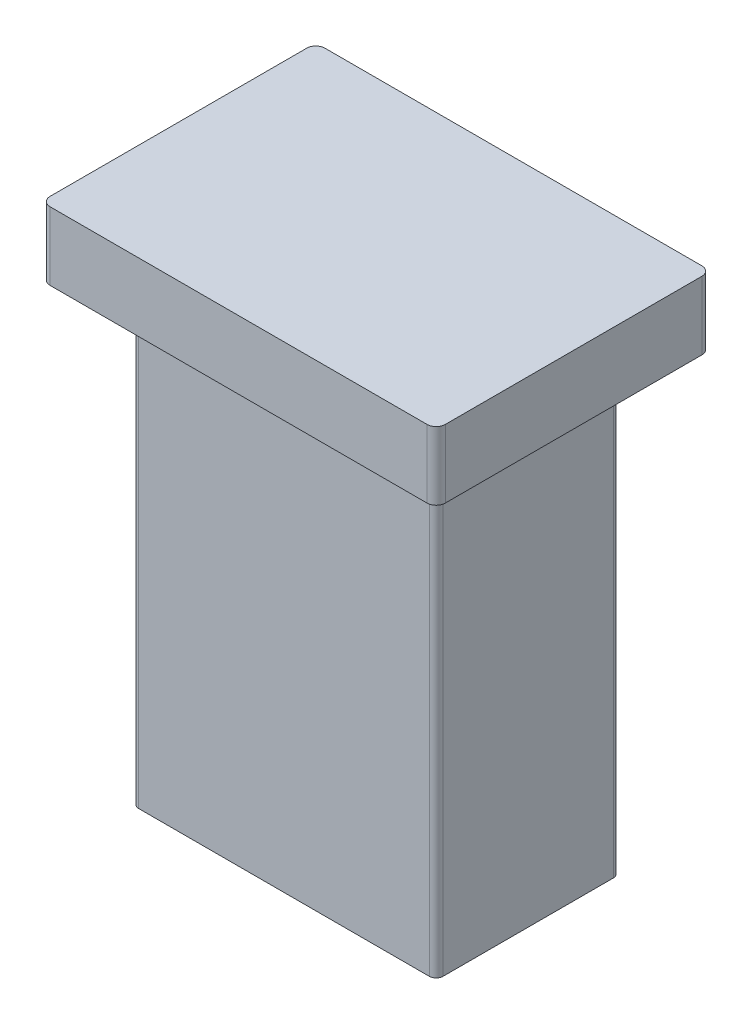
from build123d import *

# Parameters (mm, degrees)
SKETCH6_W           = 67
SKETCH6_H           = 40.5
BOSS_EXTRUDE1_DEPTH = 105
CUT_LOFT3_START     = -29.9999999
CUT_LOFT3_DEPTH     = 29.9999998
CUT_LOFT3_START_2   = -7.115817743
CUT_LOFT3_2_DEPTH   = 64.231635486
CUT_LOFT3_START_3   = -35
CUT_LOFT3_3_DEPTH   = 40
SKETCH7_W           = 67
SKETCH7_H           = 40.5
BOSS_EXTRUDE2_DEPTH = 10
SKETCH8_W           = 87
SKETCH8_H           = 60.5
SKETCH8_W_2         = 67
SKETCH8_H_2         = 40.5
BOSS_EXTRUDE3_DEPTH = 15
FILLET1_R           = 1.5
FILLET2_R           = 2


with BuildPart() as part:
    # Sketch6 → Boss-Extrude1 (new body)
    with BuildSketch(Plane(origin=(0, -105, 0), x_dir=(-1, 0, 0), z_dir=(0, -1, 0))):
        with Locations((-25, 15)):
            Rectangle(SKETCH6_W, SKETCH6_H)
    extrude(amount=-BOSS_EXTRUDE1_DEPTH)

    # Cut-Loft3: read off the stored shape, not the designer's step
    # Cut-Loft3 outline → Cut-Loft3 (cut)
    with BuildSketch(Plane.XY.offset(CUT_LOFT3_START)):
        with BuildLine():
            Line((50, 0), (0, 0))
            add(Edge.make_bspline(
                [(0, 0), (-2.619218241, -3.17616721), (-8.184453474, -20.412928603), (-4.859899163, -50.249112036), (-7.237735503, -81.623890808), (-7.133275036, -98.330418488), (-7, -105)],
                knots=[0, 0, 0, 0, 0.103246402, 0.528052801, 0.811273442, 1, 1, 1, 1], degree=3))
            Line((-7, -105), (57, -105))
            add(Edge.make_bspline(
                [(50, 0), (52.619218241, -3.17616721), (58.184453474, -20.412928603), (54.859899163, -50.249112036), (57.237735503, -81.623890808), (57.133275036, -98.330418488), (57, -105)],
                knots=[0, 0, 0, 0, 0.103246402, 0.528052801, 0.811273442, 1, 1, 1, 1], degree=3))
        make_face()
    extrude(amount=CUT_LOFT3_DEPTH, mode=Mode.SUBTRACT)

    # Cut-Loft3 2 outline → Cut-Loft3 2 (cut)
    with BuildSketch(Plane.YZ.offset(CUT_LOFT3_START_2)):
        with BuildLine():
            Line((-105, 3.75), (-105, -1e-07))
            Line((-105, -1e-07), (0, 0))
            add(Edge.make_bspline(
                [(0, 0), (-3.17616721, 1.476275787), (-20.412928603, 4.531326169), (-50.249112036, 2.35522903), (-81.623890808, 3.554586021), (-98.330418488, 3.683289611), (-105, 3.75)],
                knots=[0, 0, 0, 0, 0.103246402, 0.528052801, 0.811273442, 1, 1, 1, 1], degree=3))
        make_face()
        with BuildLine():
            add(Edge.make_bspline(
                [(0, -30), (-3.17616721, -31.476275787), (-20.412928603, -34.531326169), (-50.249112036, -32.35522903), (-81.623890808, -33.554586021), (-98.330418488, -33.683289611), (-105, -33.75)],
                knots=[0, 0, 0, 0, 0.103246402, 0.528052801, 0.811273442, 1, 1, 1, 1], degree=3))
            Line((0, -30), (-105, -29.9999999))
            Line((-105, -29.9999999), (-105, -33.75))
        make_face()
    extrude(amount=CUT_LOFT3_2_DEPTH, mode=Mode.SUBTRACT)

    # Cut-Loft3 3 outline → Cut-Loft3 3 (add)
    with BuildSketch(Plane.XY.offset(CUT_LOFT3_START_3)):
        with BuildLine():
            add(Edge.make_bspline(
                [(-7.115817743, -94.852346436), (-7.111621237, -98.234097595), (-7.067571178, -101.618485404), (-7, -105)],
                knots=[0.904314594, 0.904314594, 0.904314594, 0.904314594, 1, 1, 1, 1], degree=3))
            Line((-7.115817743, -94.852346436), (-7.115817743, -105))
            Line((-7.115817743, -105), (-7, -105))
        make_face()
        with BuildLine():
            Line((57.115817743, -105), (57.115817743, -94.852346435))
            add(Edge.make_bspline(
                [(57.115817743, -94.852346435), (57.111621237, -98.234097594), (57.067571178, -101.618485403), (57, -105)],
                knots=[0.904314594, 0.904314594, 0.904314594, 0.904314594, 1, 1, 1, 1], degree=3))
            Line((57, -105), (57.115817743, -105))
        make_face()
        with BuildLine():
            Line((0, 0), (-7.115817743, 0))
            Line((-7.115817743, 0), (-7.115817743, -93.799100649))
            add(Edge.make_bspline(
                [(0, 0), (-2.619218241, -3.17616721), (-8.184453474, -20.412928603), (-4.859899163, -50.249112036), (-6.957672976, -77.928556656), (-7.11212194, -90.862443231), (-7.115817743, -93.799100649)],
                knots=[0, 0, 0, 0, 0.103246402, 0.528052801, 0.811273442, 0.894379998, 0.894379998, 0.894379998, 0.894379998], degree=3))
        make_face()
        with BuildLine():
            Line((57.115817743, 0), (50, 0))
            add(Edge.make_bspline(
                [(50, 0), (52.619218241, -3.17616721), (58.184453474, -20.412928603), (54.859899163, -50.249112036), (56.957672976, -77.928556656), (57.11212194, -90.862443232), (57.115817743, -93.79910065)],
                knots=[0, 0, 0, 0, 0.103246402, 0.528052801, 0.811273442, 0.894379998, 0.894379998, 0.894379998, 0.894379998], degree=3))
            Line((57.115817743, -93.79910065), (57.115817743, 0))
        make_face()
    extrude(amount=CUT_LOFT3_3_DEPTH)

    # Sketch7 → Boss-Extrude2 (add)
    with BuildSketch(Plane(origin=(0, 0, 0), x_dir=(1, 0, 0), z_dir=(0, 1, 0))):
        with Locations((25, 15)):
            Rectangle(SKETCH7_W, SKETCH7_H)
    extrude(amount=BOSS_EXTRUDE2_DEPTH)

    # Sketch8 → Boss-Extrude3 (add)
    with BuildSketch(Plane(origin=(0, 10, 0), x_dir=(1, 0, 0), z_dir=(0, 1, 0))):
        with Locations((25, 15)):
            Rectangle(SKETCH8_W, SKETCH8_H)
        with Locations((25, 15)):
            Rectangle(SKETCH8_W_2, SKETCH8_H_2, mode=Mode.SUBTRACT)
    extrude(amount=-BOSS_EXTRUDE3_DEPTH)

    # Fillet1
    fillet1_edges = [part.edges().sort_by_distance(p)[0] for p in [
        (-8.5, -55, -35.25),
        (58.5, -55, -35.25),
        (58.5, -55, 5.25),
        (-8.5, -55, 5.25),
    ]]
    fillet(fillet1_edges, radius=FILLET1_R)

    # Fillet2
    fillet2_edges = [part.edges().sort_by_distance(p)[0] for p in [
        (68.5, 2.5, -45.25),
        (68.5, 2.5, 15.25),
        (-18.5, 2.5, 15.25),
        (-18.5, 2.5, -45.25),
        (25, -5, 5.25),
        (-8.5, -5, -15),
        (58.5, -5, -15),
        (25, -5, -35.25),
        (-8.060660172, -5, 4.810660172),
        (58.060660172, -5, 4.810660172),
        (58.060660172, -5, -34.810660172),
        (-8.060660172, -5, -34.810660172),
    ]]
    fillet(fillet2_edges, radius=FILLET2_R)


solid = part.part
